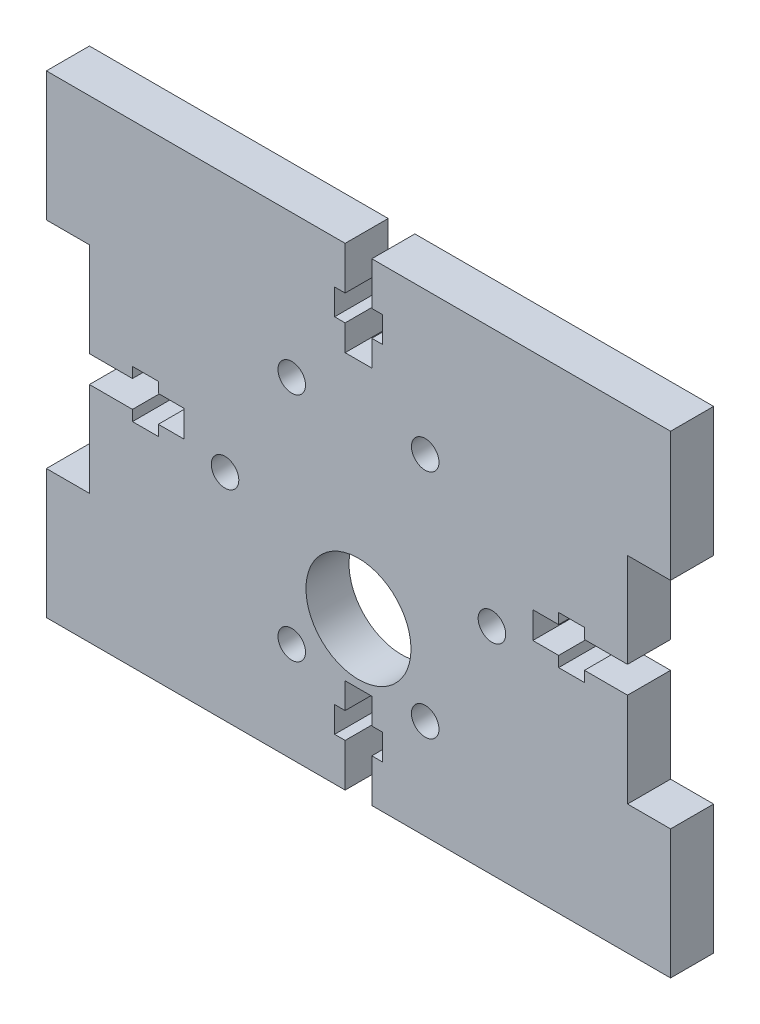
from build123d import *

# Parameters (mm, degrees)
ESQUISSE1_W                       = 26.253582595
ESQUISSE1_H                       = 55
BOSS_EXTRU_1_DEPTH                = 5
BOSS_EXTRU_2_DEPTH                = 5
BOSS_EXTRU_3_DEPTH                = 5
ENL_V_MAT_EXTRU_1_DEPTH           = 5
ESQUISSE5_W                       = 5
ESQUISSE5_H                       = 50
BOSS_EXTRU_4_DEPTH                = 36.246417405
BOSS_EXTRU_5_DEPTH                = 5
BOSS_EXTRU_6_DEPTH                = 5
BOSS_EXTRU_7_DEPTH                = 5
DIAM_TRE_DU_PER_AGE_12_2_12_2_1_D = 12.2
DIAM_TRE_DU_PER_AGE_3_2_3_2_1_D   = 3.2
CONG_1_R                          = 1.6
ESQUISSE13_W                      = 5
ESQUISSE13_H                      = 2.95
ESQUISSE13_W_2                    = 15.89283481
ESQUISSE13_H_2                    = 5
BOSS_EXTRU_8_DEPTH                = 5
ENL_V_MAT_EXTRU_2_DEPTH           = 5


with BuildPart() as part:
    # Esquisse1 → Boss.-Extru.1 (new body)
    with BuildSketch(Plane(origin=(0, 0, 0), x_dir=(-1, 0, 0), z_dir=(0, 0, -1))):
        with Locations((-18.123208703, 2.5)):
            Rectangle(ESQUISSE1_W, ESQUISSE1_H)
    extrude(amount=-BOSS_EXTRU_1_DEPTH)

    # Esquisse2 → Boss.-Extru.2 (add)
    with BuildSketch(Plane(origin=(31.25, 0, 0), x_dir=(0, 0, -1), z_dir=(1, 0, 0))):
        Polygon((0, 15), (-2.05, 15), (-5, 17.95), (-5, 30), (0, 30), align=None)
    extrude(amount=BOSS_EXTRU_2_DEPTH)

    # Esquisse3 → Boss.-Extru.3 (add)
    with BuildSketch(Plane(origin=(31.25, 0, 0), x_dir=(0, 0, -1), z_dir=(1, 0, 0))):
        Polygon((-5, -12.95), (-2.05, -10), (0, -10), (0, -25), (-5, -25), align=None)
    extrude(amount=BOSS_EXTRU_3_DEPTH)

    # Esquisse4 → Enlèv. mat.-Extru.1 (cut)
    with BuildSketch(Plane(origin=(0, 30, 0), x_dir=(-1, 0, 0), z_dir=(0, 1, 0))):
        Polygon((-4.996417405, 5), (-7.946417405, 5), (-4.996417405, 2.05), align=None)
    extrude(amount=-ENL_V_MAT_EXTRU_1_DEPTH, mode=Mode.SUBTRACT)

    # Esquisse5 → Boss.-Extru.4 (add)
    with BuildSketch(Plane.ZY.offset(-4.996417405)):
        with Locations((2.5, 0)):
            Rectangle(ESQUISSE5_W, ESQUISSE5_H)
    extrude(amount=BOSS_EXTRU_4_DEPTH)

    # Esquisse6 → Boss.-Extru.5 (add)
    with BuildSketch(Plane.ZY.offset(31.25)):
        Polygon((0, -25), (0, -10), (2.05, -10), (5, -12.95), (5, -25), align=None)
    extrude(amount=BOSS_EXTRU_5_DEPTH)

    # Esquisse7 → Boss.-Extru.6 (add)
    with BuildSketch(Plane.ZY.offset(31.25)):
        Polygon((0, 25), (5, 25), (5, 17.95), (2.05, 15), (0, 15), align=None)
    extrude(amount=BOSS_EXTRU_6_DEPTH)

    # Esquisse8 → Boss.-Extru.7 (add)
    with BuildSketch(Plane(origin=(0, 25, 0), x_dir=(-1, 0, 0), z_dir=(0, 1, 0))):
        Polygon((5.00063887, 2.054221466), (7.946417405, 5), (36.25, 5), (36.25, 0), (5.00063887, 0), align=None)
    extrude(amount=BOSS_EXTRU_7_DEPTH)

    # Diamètre du perçage Ø12.2 (12.2)1 (through all)
    with Locations(Plane.XY.offset(5)):
        with Locations((0, -7)):
            Hole(DIAM_TRE_DU_PER_AGE_12_2_12_2_1_D / 2)

    # Diamètre du perçage Ø3.2 (3.2)1 (through all)
    with Locations(Plane.XY.offset(5)):
        with Locations((-7.75, -13.423393759), (15.5, 0), (-7.75, 13.423393759), (7.75, 13.423393759), (7.75, -13.423393759), (-15.5, 0)):
            Hole(DIAM_TRE_DU_PER_AGE_3_2_3_2_1_D / 2)

    # Congé1
    cong_1_edges = [part.edges().sort_by_distance(p)[0] for p in [
        (4.996417405, 27.5, 2.05),
        (33.75, -10, 2.05),
        (33.75, 15, 2.05),
        (-33.75, -10, 2.05),
        (-5.00063887, 27.5, 2.054221466),
        (-33.75, 15, 2.05),
    ]]
    fillet(cong_1_edges, radius=CONG_1_R)

    # Esquisse13 → Boss.-Extru.8 (add)
    with BuildSketch(Plane.XY.offset(5)):
        with Locations((-33.75, -11.475)):
            Rectangle(ESQUISSE13_W, ESQUISSE13_H)
        with Locations((-33.75, 16.475)):
            Rectangle(ESQUISSE13_W, ESQUISSE13_H)
        with Locations((0, 27.5)):
            Rectangle(ESQUISSE13_W_2, ESQUISSE13_H_2)
        with Locations((33.75, -11.475)):
            Rectangle(ESQUISSE13_W, ESQUISSE13_H)
        with Locations((33.75, 16.475)):
            Rectangle(ESQUISSE13_W, ESQUISSE13_H)
    extrude(amount=-BOSS_EXTRU_8_DEPTH)

    # Esquisse14 → Enlèv. mat.-Extru.2 (cut)
    with BuildSketch(Plane.XY.offset(5)):
        Polygon((-1.55, 19), (1.55, 19), (1.55, 22), (2.78, 22), (2.78, 25), (1.55, 25), (1.55, 30), (-1.55, 30), (-1.55, 25), (-2.77, 25), (-2.77, 22), (-1.55, 22), align=None)
        Polygon((-23.25, 0.95), (-20.25, 0.95), (-20.25, 4.05), (-23.25, 4.05), (-23.25, 5.27), (-26.25, 5.27), (-26.25, 4.05), (-31.25, 4.05), (-31.25, 0.95), (-26.25, 0.95), (-26.25, -0.28), (-23.25, -0.28), align=None)
        Polygon((23.25, -0.28), (26.25, -0.28), (26.25, 0.95), (31.25, 0.95), (31.25, 4.05), (26.25, 4.05), (26.25, 5.27), (23.25, 5.27), (23.25, 4.05), (20.25, 4.05), (20.25, 0.95), (23.25, 0.95), align=None)
        Polygon((-1.55, -17), (-2.77, -17), (-2.77, -20), (-1.55, -20), (-1.55, -25), (1.55, -25), (1.55, -20), (2.78, -20), (2.78, -17), (1.55, -17), (1.55, -14), (-1.55, -14), align=None)
    extrude(amount=-ENL_V_MAT_EXTRU_2_DEPTH, mode=Mode.SUBTRACT)


solid = part.part
